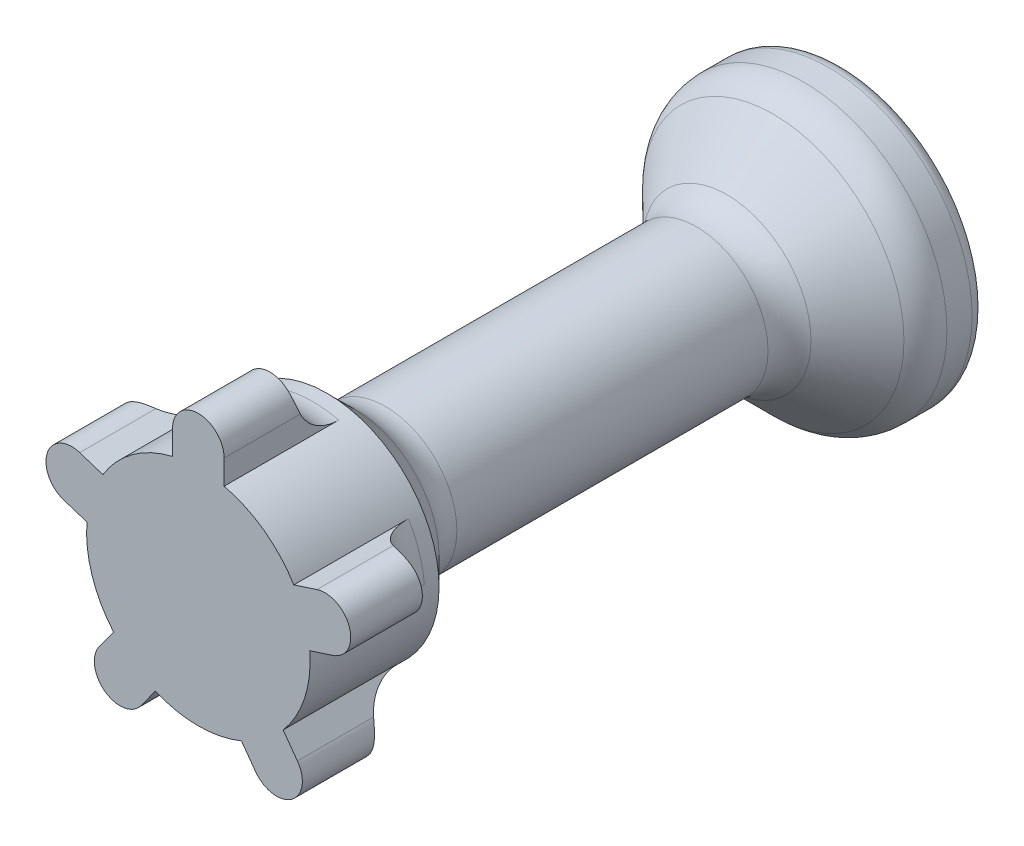
from build123d import *
from build123d.topology import SkipClean

# Parameters (mm, degrees)
SKETCH1_R           = 9.906
BOSS_EXTRUDE1_DEPTH = 6.35
FILLET1_START       = -3.8100001
FILLET1_3_DEPTH     = 3.8100001
FILLET2_R           = 1.27


with BuildPart() as part:
    # Sketch1 → Boss-Extrude1 (new body)
    with BuildSketch(Plane.XY):
        with BuildLine():
            ThreePointArc((-9.873287403, 0.804382899), (-9.42116585, 3.061122346), (-8.460461705, 5.152613292))
            Line((-8.460461705, 5.152613292), (-10.513792724, 5.819780983))
            ThreePointArc((-10.513792724, 5.819780983), (-13.394320769, 4.352078636), (-11.926618422, 1.47155059))
            Line((-11.926618422, 1.47155059), (-9.873287403, 0.804382899))
        make_face()
        Circle(SKETCH1_R)
        with BuildLine():
            Line((-5.085055556, -10.888154027), (-3.816027196, -9.141486336))
            ThreePointArc((-3.816027196, -9.141486336), (-5.822600709, -8.014122346), (-7.514852894, -6.454132163))
            Line((-7.514852894, -6.454132163), (-8.783881254, -8.200799854))
            ThreePointArc((-8.783881254, -8.200799854), (-8.278145492, -11.39388979), (-5.085055556, -10.888154027))
        make_face()
        with BuildLine():
            Line((8.783881254, -8.200799854), (7.514852894, -6.454132163))
            ThreePointArc((7.514852894, -6.454132163), (5.822600709, -8.014122346), (3.816027196, -9.141486336))
            Line((3.816027196, -9.141486336), (5.085055556, -10.888154027))
            ThreePointArc((5.085055556, -10.888154027), (8.278145492, -11.39388979), (8.783881254, -8.200799854))
        make_face()
        with BuildLine():
            Line((9.873287403, 0.804382899), (11.926618422, 1.47155059))
            ThreePointArc((11.926618422, 1.47155059), (13.394320769, 4.352078636), (10.513792724, 5.819780983))
            Line((10.513792724, 5.819780983), (8.460461705, 5.152613292))
            ThreePointArc((8.460461705, 5.152613292), (9.42116585, 3.061122346), (9.873287403, 0.804382899))
        make_face()
        with BuildLine():
            ThreePointArc((-2.286, 9.638622308), (0, 9.906), (2.286, 9.638622308))
            Line((2.286, 9.638622308), (2.286, 11.797622308))
            ThreePointArc((2.286, 11.797622308), (0, 14.083622308), (-2.286, 11.797622308))
            Line((-2.286, 11.797622308), (-2.286, 9.638622308))
        make_face()
    extrude(amount=BOSS_EXTRUDE1_DEPTH)

    # Sketch2 → Revolve1 (revolve)
    with SkipClean():  # the faces are left unmerged after this step: merging them gives an invalid solid
        with BuildSketch(Plane(origin=(0, 0, 0), x_dir=(1, 0, 0), z_dir=(0, 1, 0))):
            Polygon((0, 50.8), (0, 0), (9.906, 0), (9.906, 5.08), (6.35, 8.636), (6.35, 39.37), (12.7, 45.72), (12.7, 50.8), align=None)
        revolve(axis=Axis((0, 0, 0), (0, 0, -1)))
    add(part.part.scale(1), mode=Mode.REPLACE)  # the faces are merged on a copy

    # Fillet1: read off the stored shape, not the designer's step
    # Fillet1 outline → Fillet1 (revolve, cut)
    with BuildSketch(Plane.XZ):
        with BuildLine():
            Line((12.7, -44.604076836), (11.584076836, -44.604076836))
            ThreePointArc((11.584076836, -44.604076836), (12.409981019, -45.840129795), (12.7, -47.298153673))
            Line((12.7, -47.298153673), (12.7, -44.604076836))
        make_face()
    revolve(axis=Axis((0, 0, 0), (0, 0, 1)), mode=Mode.SUBTRACT)

    # Fillet1 2 outline → Fillet1 2 (revolve)
    with BuildSketch(Plane.XZ):
        with BuildLine():
            Line((6.35, -40.485923164), (7.465923164, -40.485923164))
            ThreePointArc((7.465923164, -40.485923164), (6.640018981, -39.249870205), (6.35, -37.791846327))
            Line((6.35, -37.791846327), (6.35, -40.485923164))
        make_face()
        with BuildLine():
            Line((6.35, -7.520076836), (6.35, -10.214153673))
            ThreePointArc((6.35, -10.214153673), (6.640018981, -8.756129795), (7.465923164, -7.520076836))
            Line((7.465923164, -7.520076836), (6.35, -7.520076836))
        make_face()
    revolve(axis=Axis((0, 0, 0), (0, 0, 1)))

    # Fillet1 3 outline → Fillet1 3 (add)
    with BuildSketch(Plane.XY.offset(FILLET1_START)):
        with BuildLine():
            Line((-11.926618422, 1.47155059), (-9.873287403, 0.804382899))
            ThreePointArc((-9.873287403, 0.804382899), (-9.42116585, 3.061122346), (-8.460461705, 5.152613292))
            Line((-8.460461705, 5.152613292), (-10.513792724, 5.819780983))
            ThreePointArc((-10.513792724, 5.819780983), (-13.394320769, 4.352078635), (-11.926618422, 1.47155059))
        make_face()
        with BuildLine():
            ThreePointArc((-3.816027196, -9.141486336), (-5.822600709, -8.014122346), (-7.514852894, -6.454132163))
            Line((-7.514852894, -6.454132163), (-8.783881254, -8.200799854))
            ThreePointArc((-8.783881254, -8.200799854), (-8.278145492, -11.39388979), (-5.085055556, -10.888154027))
            Line((-5.085055556, -10.888154027), (-3.816027196, -9.141486336))
        make_face()
        with BuildLine():
            Line((-2.286, 11.797622308), (-2.286, 9.638622308))
            ThreePointArc((-2.286, 9.638622308), (0, 9.906), (2.286, 9.638622308))
            Line((2.286, 9.638622308), (2.286, 11.797622308))
            ThreePointArc((2.286, 11.797622308), (0, 14.083622308), (-2.286, 11.797622308))
        make_face()
        with BuildLine():
            ThreePointArc((7.514852894, -6.454132163), (5.822600709, -8.014122346), (3.816027196, -9.141486336))
            Line((3.816027196, -9.141486336), (5.085055556, -10.888154027))
            ThreePointArc((5.085055556, -10.888154027), (8.278145492, -11.39388979), (8.783881254, -8.200799854))
            Line((8.783881254, -8.200799854), (7.514852894, -6.454132163))
        make_face()
        with BuildLine():
            Line((10.513792724, 5.819780983), (8.460461705, 5.152613292))
            ThreePointArc((8.460461705, 5.152613292), (9.42116585, 3.061122346), (9.873287403, 0.804382899))
            Line((9.873287403, 0.804382899), (11.926618422, 1.47155059))
            ThreePointArc((11.926618422, 1.47155059), (13.394320769, 4.352078635), (10.513792724, 5.819780983))
        make_face()
    extrude(amount=FILLET1_3_DEPTH)

    # Fillet1 4 outline → Fillet1 4 (revolve, cut)
    with BuildSketch(Plane.XZ):
        with BuildLine():
            Line((14.083622308, 0), (13.716, 0))
            ThreePointArc((13.716, 0), (11.021923164, -1.115923164), (9.906, -3.81))
            Line((9.906, -3.81), (14.083622308, -3.8100001))
            Line((14.083622308, -3.8100001), (14.083622308, 0))
        make_face()
    revolve(axis=Axis((0, 0, 0), (0, 0, 1)), mode=Mode.SUBTRACT)

    # Fillet2
    fillet2_edges = [part.edges().sort_by_distance(p)[0] for p in [
        (-12.7, 0, -50.8),
    ]]
    fillet(fillet2_edges, radius=FILLET2_R)


solid = part.part
